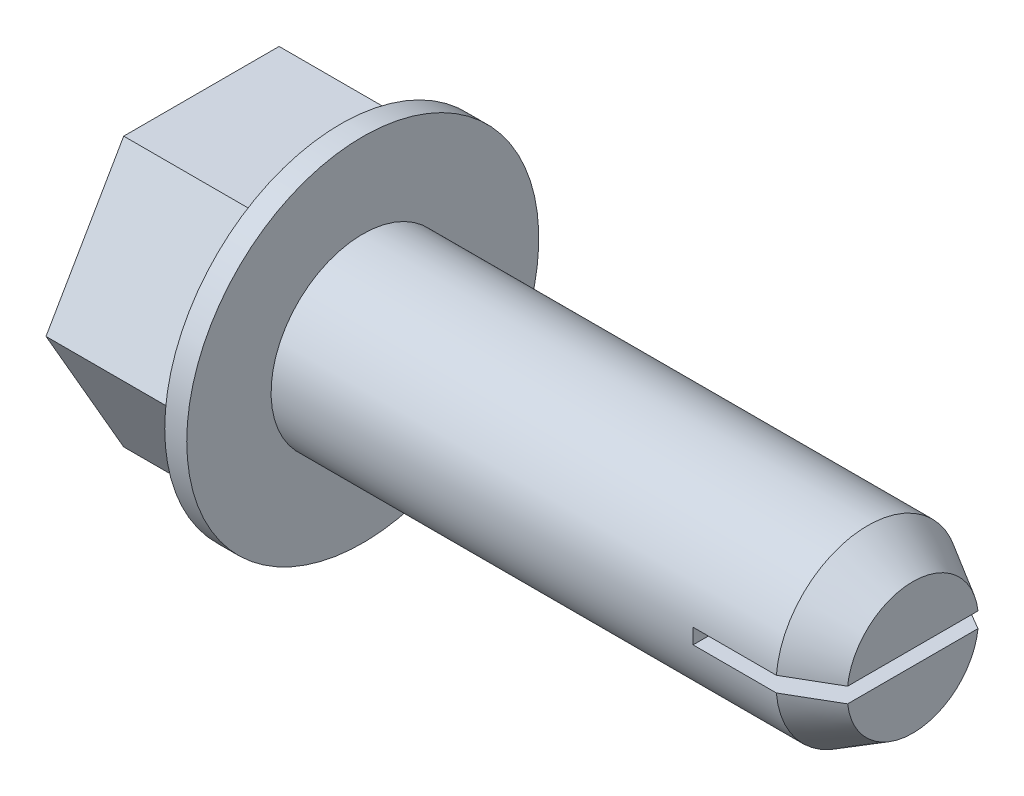
from build123d import *
from OCP.BRepFilletAPI import BRepFilletAPI_MakeChamfer
from build123d.topology import SkipClean

# Parameters (mm, degrees)
SKETCH1_W                  = 0.762
SKETCH1_H                  = 6.096
SKETCH2_R                  = 3.175
BOSS_EXTRUDE1_DEPTH        = 19.05
CUT_EXTRUDE1_START         = -4.445
CUT_EXTRUDE1_DEPTH         = 4.445
BOSS_EXTRUDE2_DEPTH        = 4.445
BOSS_EXTRUDE3_DEPTH        = 4.826
M6_5_CLEARANCE_HOLE1_D     = 7.45744
M6_5_CLEARANCE_HOLE1_DEPTH = 0.9652
CHAMFER1_SIZE              = 0.9017
CHAMFER1_SIZE2             = 1.561790213


with BuildPart() as part:
    # Sketch1 → Revolve1 (revolve)
    with BuildSketch(Plane(origin=(0, 0, 0), x_dir=(-1, 0, 0), z_dir=(0, 0, -1))):
        with Locations((0.381, 3.048)):
            Rectangle(SKETCH1_W, SKETCH1_H)
    revolve(axis=Axis((0, 0, 0), (-1, 0, 0)))

    # Sketch2 → Boss-Extrude1 (add)
    with BuildSketch(Plane(origin=(0, 0, 0), x_dir=(0, 0, -1), z_dir=(1, 0, 0))):
        Circle(SKETCH2_R)
    extrude(amount=BOSS_EXTRUDE1_DEPTH)

    # Sketch3 → Cut-Extrude1 (cut)
    with BuildSketch(Plane(origin=(19.05, 0, 0), x_dir=(0, 0, -1), z_dir=(1, 0, 0)).offset(CUT_EXTRUDE1_START)):
        with BuildLine():
            Line((-3.163956488, -0.264583333), (3.163956488, -0.264583333))
            ThreePointArc((3.163956488, -0.264583333), (0, 3.175), (-3.163956488, -0.264583333))
        make_face()
    extrude(amount=CUT_EXTRUDE1_DEPTH, mode=Mode.SUBTRACT)

    # Sketch4 → Boss-Extrude2 (add)
    with SkipClean():  # the faces are left unmerged after this step: merging them gives an invalid solid
        with BuildSketch(Plane(origin=(14.605, 0, 0), x_dir=(0, 0, -1), z_dir=(1, 0, 0))):
            with BuildLine():
                Line((3.163956488, 0.264583333), (-3.163956488, 0.264583333))
                ThreePointArc((-3.163956488, 0.264583333), (0, 3.175), (3.163956488, 0.264583333))
            make_face()
        extrude(amount=BOSS_EXTRUDE2_DEPTH)

    # Sketch5 → Boss-Extrude3 (add)
    with SkipClean():  # the faces are left unmerged after this step: merging them gives an invalid solid
        with BuildSketch(Plane.ZY.offset(0.762)):
            Polygon((-2.69097187, -4.6609), (-5.381943739, 0), (-2.69097187, 4.6609), (2.69097187, 4.6609), (5.381943739, 0), (2.69097187, -4.6609), align=None)
        extrude(amount=BOSS_EXTRUDE3_DEPTH)

    # M6.5 Clearance Hole1
    with Locations(Plane.ZY.offset(5.588)):
        with Locations((0, 0)):
            Hole(M6_5_CLEARANCE_HOLE1_D / 2, depth=M6_5_CLEARANCE_HOLE1_DEPTH)

    # Chamfer1: one chamfer whose edges measure the first distance from different faces: ONE call of the kernel's chamfer builder (chamfer() names one face for all edges)
    chamfer1_edges_1 = [part.edges().sort_by_distance(p)[0] for p in [
        (19.05, 3.175, 0),
    ]]
    chamfer1_side_1 = [part.faces().sort_by_distance(p)[0] for p in [
        (19.05, 1.491577602, 0),
    ]]
    chamfer1_edges_2 = [part.edges().sort_by_distance(p)[0] for p in [
        (19.05, -3.175, 0),
    ]]
    chamfer1_side_2 = [part.faces().sort_by_distance(p)[0] for p in [
        (19.05, -1.491577602, 0),
    ]]
    chamfer1 = BRepFilletAPI_MakeChamfer(part.part.solid().wrapped)
    for e in chamfer1_edges_1:
        chamfer1.Add(CHAMFER1_SIZE, CHAMFER1_SIZE2, e.wrapped, chamfer1_side_1[0].wrapped)  # the first distance lies on this face
    for e in chamfer1_edges_2:
        chamfer1.Add(CHAMFER1_SIZE, CHAMFER1_SIZE2, e.wrapped, chamfer1_side_2[0].wrapped)  # the first distance lies on this face
    add(Compound.cast(chamfer1.Shape()), mode=Mode.REPLACE)


solid = part.part
